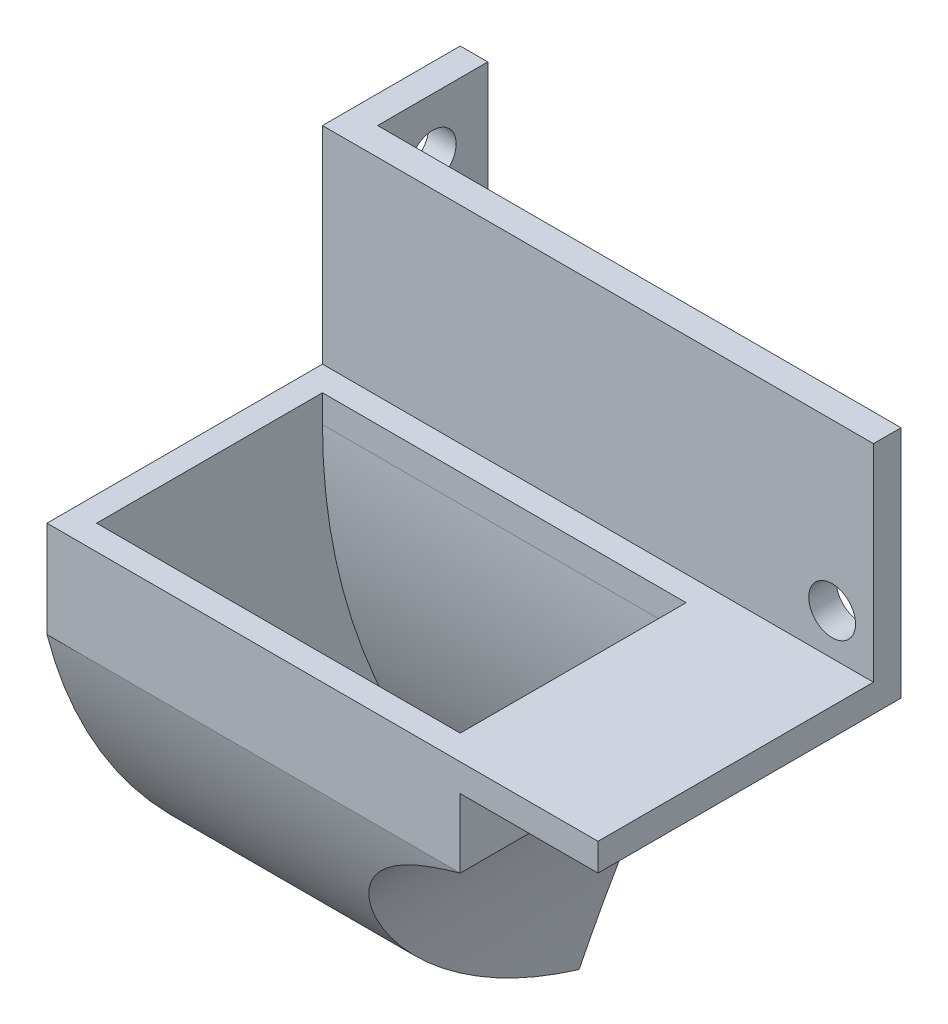
from build123d import *

# Parameters (mm, degrees)
SKETCH_1_W               = 30
SKETCH_1_H               = 25
EXTRUDE_1_DEPTH          = 30
CUT_EXTRUDE_START        = -25
CUT_EXTRUDE_1_DEPTH      = 25
CUT_EXTRUDE_START_2      = -30
CUT_EXTRUDE_2_DEPTH      = 30
CUT_EXTRUDE_3_DEPTH      = 45.229515196
CUT_EXTRUDE_3_DEPTH_BACK = 45.229515196
CUT_EXTRUDE_4_DEPTH      = 45.229515196
CUT_EXTRUDE_4_DEPTH_BACK = 45.229515196
SHELL_2_T                = -1.8
SKETCH_8_W               = 40
SKETCH_8_H               = 20
SKETCH_8_W_2             = 26.4
SKETCH_8_H_2             = 16.4
EXTRUDE_2_DEPTH          = 2
EXTRUDE_3_DEPTH          = 15
EXTRUDE_3_DEPTH_BACK     = 2
SKETCH_9_W               = 40
SKETCH_9_H               = 2
SKETCH_10_W              = 2
SKETCH_10_H              = 17
EXTRUDE_4_DEPTH          = 8
CUT_EXTRUDE_5_REACH      = 66.15
SKETCH_13_R              = 1.7
CUT_EXTRUDE_6_REACH      = 59.602
SKETCH_14_R              = 1.7


# Read off the part's stored shape, not the designer's step: 切除-拉伸1, 切除-拉伸2
with BuildPart() as part:
    # 草图1 → 凸台-拉伸1 (new body)
    with BuildSketch(Plane(origin=(0, 0, 0), x_dir=(1, 0, 0), z_dir=(0, 1, 0))):
        Rectangle(SKETCH_1_W, SKETCH_1_H)
    extrude(amount=EXTRUDE_1_DEPTH)

    # 切除-拉伸1 outline → 切除-拉伸1 (cut)
    with BuildSketch(Plane(origin=(0, 0, -12.5), x_dir=(-1, 0, 0), z_dir=(0, 0, -1)).offset(CUT_EXTRUDE_START)):
        with BuildLine():
            add(Edge.make_bspline(
                [(-15, 25), (-6.511377405, 22.051776189), (-3.763777339, 18.136586702), (-1, 0)],
                knots=[0, 0, 0, 0, 1, 1, 1, 1], degree=3))
            Line((-15, 25), (-15, 0))
            Line((-15, 0), (-1, 0))
        make_face()
    extrude(amount=CUT_EXTRUDE_1_DEPTH, mode=Mode.SUBTRACT)

    # 切除-拉伸2 outline → 切除-拉伸2 (cut)
    with BuildSketch(Plane.ZY.offset(15).offset(CUT_EXTRUDE_START_2)):
        with BuildLine():
            add(Edge.make_bspline(
                [(-7.5, 30), (-7.5, 23.858714032), (-8.903080152, 17.199411136), (-12.5, 10)],
                knots=[0, 0, 0, 0, 1, 1, 1, 1], degree=3))
            Line((-7.5, 30), (-12.5, 30))
            Line((-12.5, 30), (-12.5, 10))
        make_face()
    extrude(amount=CUT_EXTRUDE_2_DEPTH, mode=Mode.SUBTRACT)

    # 草图6 → 切除-拉伸3 (cut, two sides: drawn at the far end of the back side and taken through both)
    with BuildSketch(Plane.ZY.offset(15).offset(-CUT_EXTRUDE_3_DEPTH_BACK)):
        with BuildLine():
            Line((34.396469071, 110.338119425), (12.5, 25))
            ThreePointArc((12.5, 25), (3.420693976, 9.079306024), (-12.5, 0))
            Line((-12.5, 0), (-97.838119425, -21.896469071))
            Line((-97.838119425, -21.896469071), (26.757626769, -146.492215265))
            Line((26.757626769, -146.492215265), (158.992215265, -14.257626769))
            Line((158.992215265, -14.257626769), (34.396469071, 110.338119425))
        make_face()
    extrude(amount=CUT_EXTRUDE_3_DEPTH + CUT_EXTRUDE_3_DEPTH_BACK, mode=Mode.SUBTRACT)

    # 草图7 → 切除-拉伸4 (cut, two sides: drawn at the far end of the back side and taken through both)
    with BuildSketch(Plane.ZY.offset(15).offset(-CUT_EXTRUDE_4_DEPTH_BACK)):
        Polygon((-34.201614467, 90.991527796), (-12.5, 10), (-10.017865444, 0.736547724), (11.683749023, -80.254980072), (-150.299306569, -123.658209006), (-196.184670059, 47.588298863), align=None)
    extrude(amount=CUT_EXTRUDE_4_DEPTH + CUT_EXTRUDE_4_DEPTH_BACK, mode=Mode.SUBTRACT)

    # 抽壳2
    shell_2_openings = [part.faces().sort_by_distance(p)[0] for p in [
        (0, 30, 2.5),
        (-6.528277813, 5.44772403, -11.28022133),
    ]]
    offset(amount=SHELL_2_T, openings=shell_2_openings)

    # 草图8 → 凸台-拉伸2 (add)
    with BuildSketch(Plane(origin=(0, 30, 0), x_dir=(1, 0, 0), z_dir=(0, 1, 0))):
        with Locations((5, -2.5)):
            Rectangle(SKETCH_8_W, SKETCH_8_H)
        with Locations((0, -2.5)):
            Rectangle(SKETCH_8_W_2, SKETCH_8_H_2, mode=Mode.SUBTRACT)
    extrude(amount=EXTRUDE_2_DEPTH)

    # 草图9 → 凸台-拉伸3 (add, two sides: drawn at the far end of the back side and taken through both)
    with BuildSketch(Plane(origin=(0, 32, 0), x_dir=(1, 0, 0), z_dir=(0, 1, 0)).offset(-EXTRUDE_3_DEPTH_BACK)):
        with Locations((5, 8.5)):
            Rectangle(SKETCH_9_W, SKETCH_9_H)
    extrude(amount=EXTRUDE_3_DEPTH + EXTRUDE_3_DEPTH_BACK)

    # 草图10 → 凸台-拉伸4 (add)
    with BuildSketch(Plane(origin=(0, 0, -9.5), x_dir=(-1, 0, 0), z_dir=(0, 0, -1))):
        with Locations((14, 38.5)):
            Rectangle(SKETCH_10_W, SKETCH_10_H)
    extrude(amount=EXTRUDE_4_DEPTH)

    # 草图13 → 切除-拉伸5 (cut, up to next)
    with BuildSketch(Plane.ZY.offset(15), mode=Mode.PRIVATE) as cut_extrude_5_sk1:
        with Locations((-13.5, 43)):
            Circle(SKETCH_13_R)
    cut_extrude_5_tool1 = extrude(cut_extrude_5_sk1.sketch, amount=-CUT_EXTRUDE_5_REACH, mode=Mode.PRIVATE) & part.part
    # 草图13 → 切除-拉伸5 (cut, up to next)
    with BuildSketch(Plane.ZY.offset(15), mode=Mode.PRIVATE) as cut_extrude_5_sk2:
        with Locations((-13.5, 35)):
            Circle(SKETCH_13_R)
    cut_extrude_5_tool2 = extrude(cut_extrude_5_sk2.sketch, amount=-CUT_EXTRUDE_5_REACH, mode=Mode.PRIVATE) & part.part
    add(cut_extrude_5_tool1.solids().sort_by_distance((-15, 43, -13.5))[0], mode=Mode.SUBTRACT)
    add(cut_extrude_5_tool2.solids().sort_by_distance((-15, 35, -13.5))[0], mode=Mode.SUBTRACT)

    # 草图14 → 切除-拉伸6 (cut, up to next)
    with BuildSketch(Plane(origin=(0, 0, -9.5), x_dir=(-1, 0, 0), z_dir=(0, 0, -1)), mode=Mode.PRIVATE) as cut_extrude_6_sk1:
        with Locations((-22, 35)):
            Circle(SKETCH_14_R)
    cut_extrude_6_tool1 = extrude(cut_extrude_6_sk1.sketch, amount=-CUT_EXTRUDE_6_REACH, mode=Mode.PRIVATE) & part.part
    add(cut_extrude_6_tool1.solids().sort_by_distance((22, 35, -9.5))[0], mode=Mode.SUBTRACT)


solid = part.part
